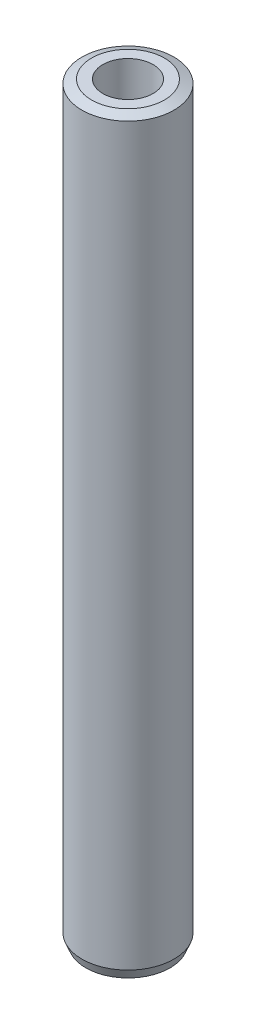
from build123d import *
from OCP.BRepFilletAPI import BRepFilletAPI_MakeChamfer

# Parameters (mm, degrees)
SKETCH1_R           = 12.5
BOSS_EXTRUDE1_DEPTH = 203.289773446
SKETCH2_R           = 6.826984009
CUT_EXTRUDE1_DEPTH  = 205.056933202
CHAMFER1_SIZE       = 1.072438363
CHAMFER1_SIZE2      = 2.61332925


with BuildPart() as part:
    # Sketch1 → Boss-Extrude1 (new body)
    with BuildSketch(Plane(origin=(0, 0, 0), x_dir=(1, 0, 0), z_dir=(0, 1, 0))):
        Circle(SKETCH1_R)
    extrude(amount=BOSS_EXTRUDE1_DEPTH)

    # Sketch2 → Cut-Extrude1 (cut, through all)
    with BuildSketch(Plane(origin=(0, 0, 0), x_dir=(1, 0, 0), z_dir=(0, 1, 0))):
        Circle(SKETCH2_R)
    extrude(amount=CUT_EXTRUDE1_DEPTH, mode=Mode.SUBTRACT)

    # Chamfer1: one chamfer whose edges measure the first distance from different faces: ONE call of the kernel's chamfer builder (chamfer() names one face for all edges)
    chamfer1_edges_1 = [part.edges().sort_by_distance(p)[0] for p in [
        (-12.5, 203.289773446, 0),
    ]]
    chamfer1_side_1 = [part.faces().sort_by_distance(p)[0] for p in [
        (-12.5, 101.644886723, 0),
    ]]
    chamfer1_edges_2 = [part.edges().sort_by_distance(p)[0] for p in [
        (-12.5, 0, 0),
    ]]
    chamfer1_side_2 = [part.faces().sort_by_distance(p)[0] for p in [
        (-12.146446609, 0, 0),
    ]]
    chamfer1 = BRepFilletAPI_MakeChamfer(part.part.solid().wrapped)
    for e in chamfer1_edges_1:
        chamfer1.Add(CHAMFER1_SIZE, CHAMFER1_SIZE2, e.wrapped, chamfer1_side_1[0].wrapped)  # the first distance lies on this face
    for e in chamfer1_edges_2:
        chamfer1.Add(CHAMFER1_SIZE, CHAMFER1_SIZE2, e.wrapped, chamfer1_side_2[0].wrapped)  # the first distance lies on this face
    add(Compound.cast(chamfer1.Shape()), mode=Mode.REPLACE)


solid = part.part
